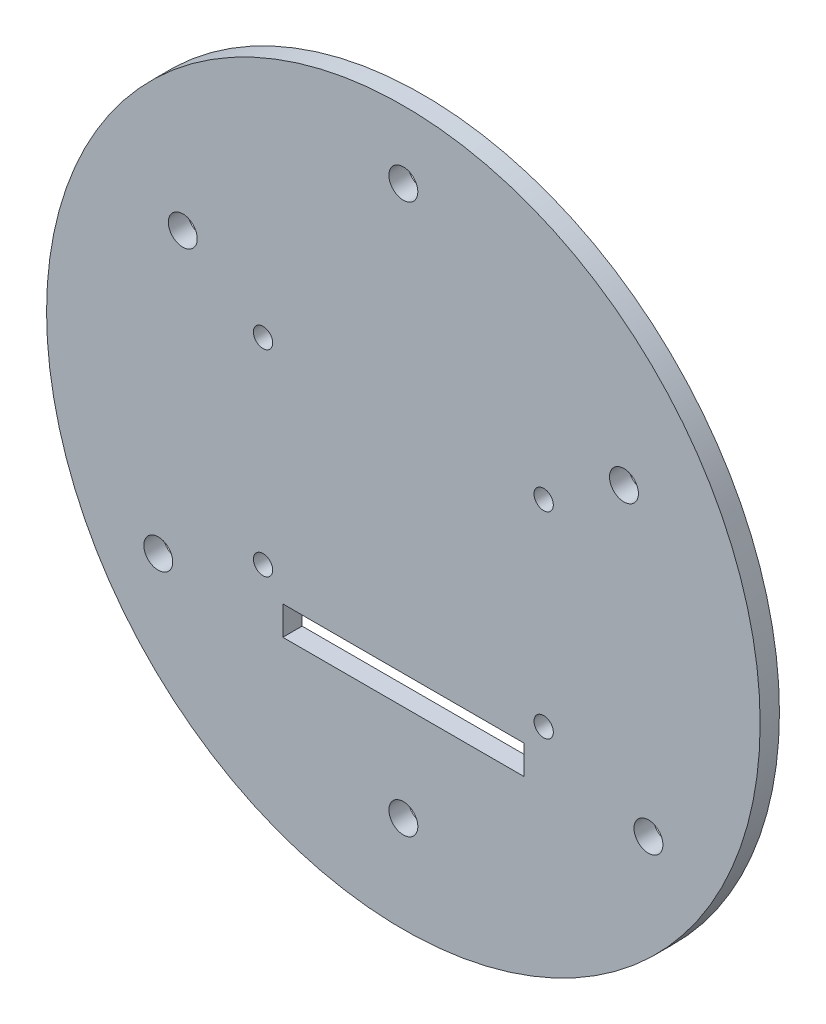
from build123d import *

# Parameters (mm, degrees)
ESQUISSE1_R             = 37
ESQUISSE1_R_2           = 1.5
ESQUISSE1_W             = 25
ESQUISSE1_H             = 3
BOSS_EXTRU_1_DEPTH      = 2
BOSS_EXTRU_2_DEPTH      = 15
ESQUISSE3_W             = 2
ESQUISSE3_H             = 28.4
BOSS_EXTRU_3_DEPTH      = 2.25
ESQUISSE5_W             = 2
ESQUISSE5_H             = 24.4
BOSS_EXTRU_4_DEPTH      = 2.25
ESQUISSE7_W             = 33.1
ESQUISSE7_H             = 28.4
BOSS_EXTRU_5_DEPTH      = 1
ESQUISSE8_W             = 15
ESQUISSE8_H             = 15
ENL_V_MAT_EXTRU_1_DEPTH = 3
ESQUISSE9_W             = 21
ESQUISSE9_H             = 2.5
ENL_V_MAT_EXTRU_2_DEPTH = 3
ESQUISSE10_R            = 1
ENL_V_MAT_EXTRU_3_DEPTH = 19
ESQUISSE11_W            = 33.1
ESQUISSE11_H            = 28.4
ENL_V_MAT_EXTRU_4_DEPTH = 15


with BuildPart() as part:
    # Esquisse1 → Boss.-Extru.1 (new body)
    with BuildSketch(Plane.XY):
        Circle(ESQUISSE1_R)
        with Locations((0, 30)):
            Circle(ESQUISSE1_R_2, mode=Mode.SUBTRACT)
        with Locations((-22.874807889, 14.34375)):
            Circle(ESQUISSE1_R_2, mode=Mode.SUBTRACT)
        with Locations((-25.416453209, -15.9375)):
            Circle(ESQUISSE1_R_2, mode=Mode.SUBTRACT)
        with Locations((0, -27)):
            Circle(ESQUISSE1_R_2, mode=Mode.SUBTRACT)
        with Locations((25.416453209, -15.9375)):
            Circle(ESQUISSE1_R_2, mode=Mode.SUBTRACT)
        with Locations((22.874807889, 14.34375)):
            Circle(ESQUISSE1_R_2, mode=Mode.SUBTRACT)
        with Locations((0, -15.5)):
            Rectangle(ESQUISSE1_W, ESQUISSE1_H, mode=Mode.SUBTRACT)
    extrude(amount=BOSS_EXTRU_1_DEPTH)

    # Esquisse2 → Boss.-Extru.2 (add)
    with BuildSketch(Plane(origin=(0, 0, 0), x_dir=(-1, 0, 0), z_dir=(0, 0, -1))):
        Polygon((-12.55, 14.9), (-16.55, 14.9), (-16.55, -13.5), (16.55, -13.5), (16.55, 14.9), (12.55, 14.9), (12.55, -9.5), (-12.55, -9.5), align=None)
    extrude(amount=BOSS_EXTRU_2_DEPTH)

    # Esquisse3 → Boss.-Extru.3 (add)
    with BuildSketch(Plane(origin=(-12.55, 0, 0), x_dir=(0, 0, -1), z_dir=(1, 0, 0))):
        with Locations((9.625, 0.7)):
            Rectangle(ESQUISSE3_W, ESQUISSE3_H)
        with Locations((6.625, 0.7)):
            Rectangle(ESQUISSE3_W, ESQUISSE3_H)
    extrude(amount=BOSS_EXTRU_3_DEPTH)

    # Esquisse5 → Boss.-Extru.4 (add)
    with BuildSketch(Plane.ZY.offset(-12.55)):
        with Locations((-9.625, 2.7)):
            Rectangle(ESQUISSE5_W, ESQUISSE5_H)
        with Locations((-6.625, 2.7)):
            Rectangle(ESQUISSE5_W, ESQUISSE5_H)
    extrude(amount=BOSS_EXTRU_4_DEPTH)

    # Esquisse7 → Boss.-Extru.5 (add)
    with BuildSketch(Plane(origin=(0, 0, -15), x_dir=(-1, 0, 0), z_dir=(0, 0, -1))):
        with Locations((0, 0.7)):
            Rectangle(ESQUISSE7_W, ESQUISSE7_H)
    extrude(amount=-BOSS_EXTRU_5_DEPTH)

    # Esquisse8 → Enlèv. mat.-Extru.1 (cut)
    with BuildSketch(Plane(origin=(0, 0, -15), x_dir=(-1, 0, 0), z_dir=(0, 0, -1))):
        Rectangle(ESQUISSE8_W, ESQUISSE8_H)
    extrude(amount=-ENL_V_MAT_EXTRU_1_DEPTH, mode=Mode.SUBTRACT)

    # Esquisse9 → Enlèv. mat.-Extru.2 (cut)
    with BuildSketch(Plane.XZ.offset(13.5)):
        with Locations((0, -5.65)):
            Rectangle(ESQUISSE9_W, ESQUISSE9_H)
    extrude(amount=-ENL_V_MAT_EXTRU_2_DEPTH, mode=Mode.SUBTRACT)

    # Esquisse10 → Enlèv. mat.-Extru.3 (cut)
    with BuildSketch(Plane.XY.offset(2)):
        with Locations((-14.55, 8.9)):
            Circle(ESQUISSE10_R)
        with Locations((-14.55, -11.5)):
            Circle(ESQUISSE10_R)
        with Locations((14.55, -11.5)):
            Circle(ESQUISSE10_R)
        with Locations((14.55, 8.9)):
            Circle(ESQUISSE10_R)
    extrude(amount=-ENL_V_MAT_EXTRU_3_DEPTH, mode=Mode.SUBTRACT)

    # Esquisse11 → Enlèv. mat.-Extru.4 (cut)
    with BuildSketch(Plane(origin=(0, 0, -15), x_dir=(-1, 0, 0), z_dir=(0, 0, -1))):
        with Locations((0, 0.7)):
            Rectangle(ESQUISSE11_W, ESQUISSE11_H)
    extrude(amount=-ENL_V_MAT_EXTRU_4_DEPTH, mode=Mode.SUBTRACT)


solid = part.part
